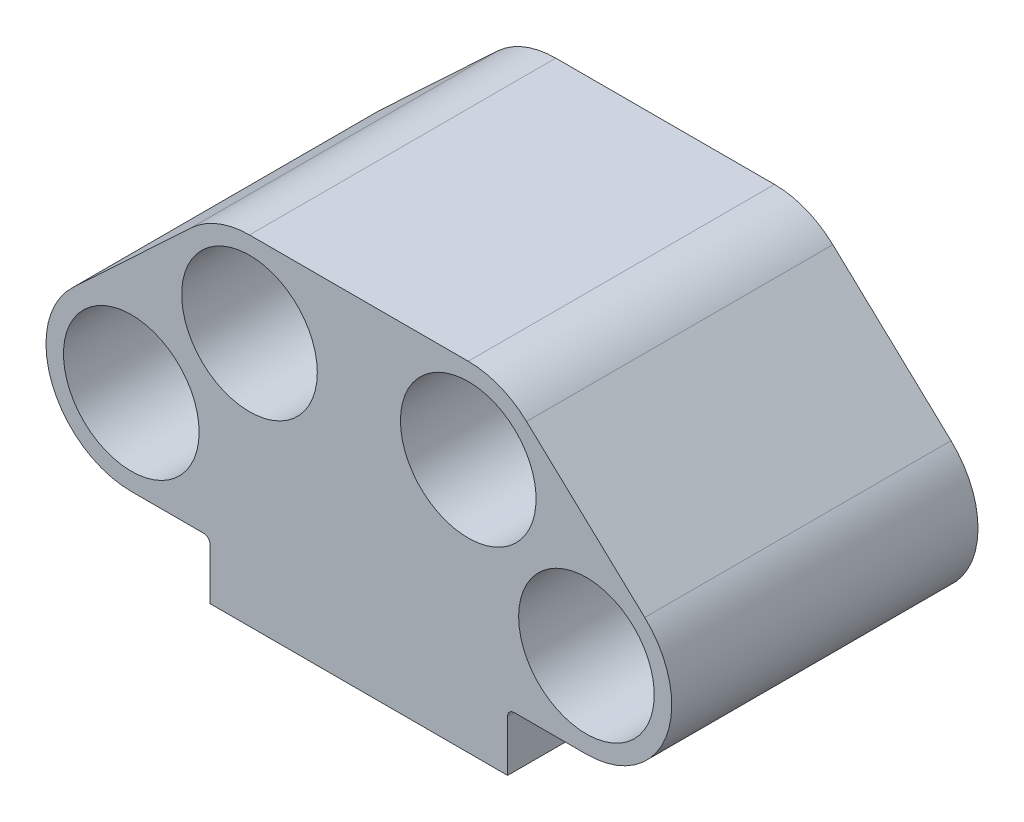
from build123d import *

# Parameters (mm, degrees)
SKETCH1_R           = 7.75
BOSS_EXTRUDE1_DEPTH = 17.5


with BuildPart() as part:
    # Sketch1 → Boss-Extrude1 (new, symmetric)
    with BuildSketch(Plane.XY):
        with BuildLine():
            Line((-19.163161706, 34.1128836), (-32.668957423, 21.469961388))
            ThreePointArc((-32.668957423, 21.469961388), (-35.073932621, 10.769948628), (-26.005795717, 4.602042024))
            Line((-26.005795717, 4.602042024), (-17.75, 4.602042024))
            ThreePointArc((-17.75, 4.602042024), (-17.219669914, 4.38237211), (-17, 3.852042024))
            Line((-17, 3.852042024), (-17, -2))
            Line((-17, -2), (0, -2))
            Line((0, -2), (0, 36.744964236))
            Line((0, 36.744964236), (-12.5, 36.744964236))
            ThreePointArc((-12.5, 36.744964236), (-16.082093396, 36.063101139), (-19.163161706, 34.1128836))
        make_face()
        with Locations((-26.005795717, 14.352042024)):
            Circle(SKETCH1_R, mode=Mode.SUBTRACT)
        with Locations((-12.5, 26.994964236)):
            Circle(SKETCH1_R, mode=Mode.SUBTRACT)
    boss_extrude1 = extrude(amount=BOSS_EXTRUDE1_DEPTH, both=True)

    # Mirror1: Boss-Extrude1 across plane
    add(boss_extrude1.mirror(Plane(origin=(0, 0, 0), x_dir=(0, 0, 1), z_dir=(1, 0, 0))))


solid = part.part
